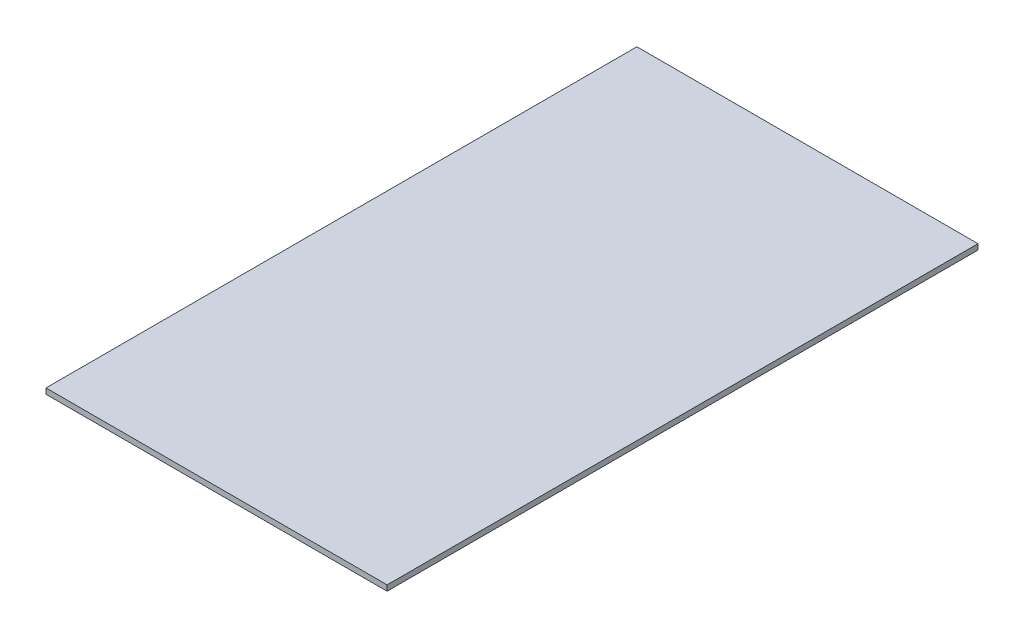
from build123d import *

# Parameters (mm, degrees)
SKETCH_1_W      = 185.06
SKETCH_1_H      = 320.59
EXTRUDE_1_DEPTH = 3


with BuildPart() as part:
    # 草图1 → 凸台-拉伸1 (new body)
    with BuildSketch(Plane(origin=(0, 0, 0), x_dir=(1, 0, 0), z_dir=(0, 1, 0))):
        Rectangle(SKETCH_1_W, SKETCH_1_H)
    extrude(amount=EXTRUDE_1_DEPTH)


solid = part.part
